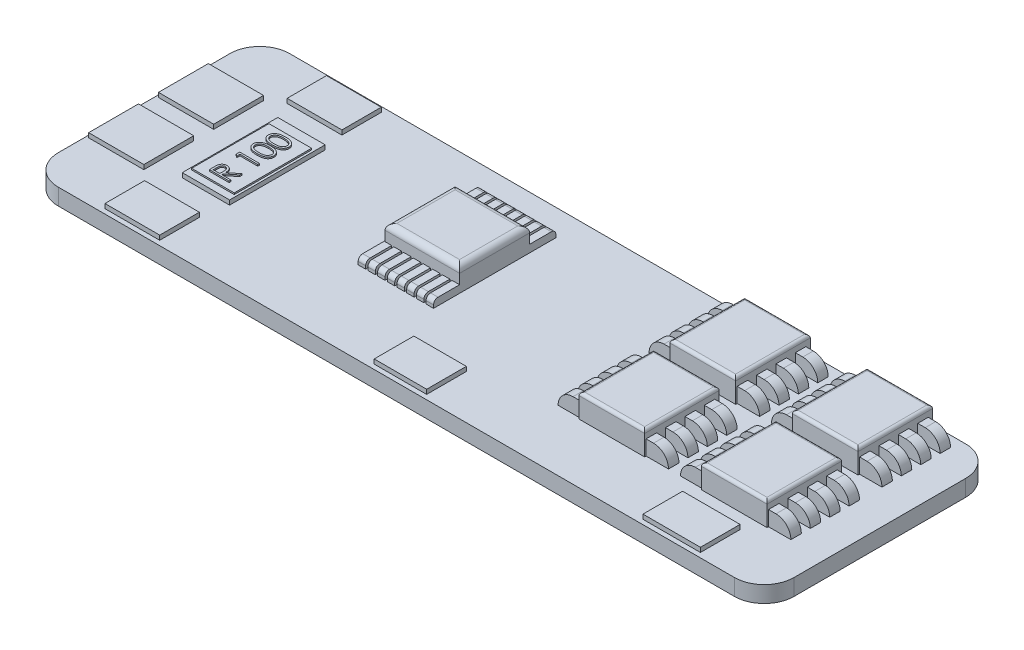
from build123d import *

# Parameters (mm, degrees)
SKETCH1_W                = 49.3
SKETCH1_H                = 15.5
BOSS_EXTRUDE1_DEPTH      = 1.1
SKETCH2_W                = 4.4
SKETCH2_H                = 5
BOSS_EXTRUDE2_DEPTH      = 1.56
SKETCH2_3_W              = 5
SKETCH2_3_H              = 4.7
BOSS_EXTRUDE3_DEPTH      = 1.56
FILLET1_R                = 0.2
SKETCH3_W                = 1.5
SKETCH3_H                = 0.7
BOSS_EXTRUDE4_DEPTH      = 1
FILLET2_R                = 1
LPATTERN1_COUNT          = 2
LPATTERN1_PITCH          = 8.2
FILLET1_OF_LPATTERN1_R   = 0.2
FILLET2_OF_LPATTERN1_R   = 1
LPATTERN2_START          = -1.23581691
LPATTERN2_DEPTH          = 5
LPATTERN2_START_2        = -0.93581691
LPATTERN2_2_DEPTH        = 0.7
LPATTERN2_START_3        = 0.36418309
LPATTERN2_3_DEPTH        = 0.7
LPATTERN2_START_4        = 1.66418309
LPATTERN2_4_DEPTH        = 0.7
LPATTERN2_START_5        = 2.96418309
LPATTERN2_5_DEPTH        = 0.7
LPATTERN2_START_6        = 7
LPATTERN2_6_DEPTH        = 15
BOSS_EXTRUDE5_DEPTH      = 0.3
BOSS_EXTRUDE5_DEPTH_BACK = 1.4
SKETCH4_W                = 3.516550639
SKETCH4_H                = 2.656524668
SKETCH4_W_2              = 3.85092248
SKETCH4_W_3              = 3.668693206
SKETCH4_W_4              = 3.699371939
SKETCH4_H_2              = 3.340875337
SKETCH4_H_3              = 3.340875338
SKETCH4_H_4              = 2.635388594
FILLET3_R                = 0.4
SKETCH5_W                = 0.5
SKETCH5_H                = 1.745261523
BOSS_EXTRUDE6_DEPTH      = 0.5
FILLET4_R                = 0.3
SKETCH6_W                = 2.855240174
SKETCH6_H                = 5.180879347
BOSS_EXTRUDE7_DEPTH      = 0.4
SKETCH7_W                = 3.172540251
SKETCH7_H                = 6.402415567
BOSS_EXTRUDE8_DEPTH      = 0.3
BOSS_EXTRUDE9_DEPTH      = 0.1
SKETCH9_OUTSIDE_W        = 61.652
SKETCH9_OUTSIDE_H        = 27.852
CUT_EXTRUDE1_DEPTH       = 10.1


with BuildPart() as part:
    # Sketch1 → Boss-Extrude1 (new body)
    with BuildSketch(Plane(origin=(0, 0, 0), x_dir=(1, 0, 0), z_dir=(0, 1, 0))):
        Rectangle(SKETCH1_W, SKETCH1_H)
    extrude(amount=BOSS_EXTRUDE1_DEPTH)

    # Sketch2 → Boss-Extrude2 (add)
    with BuildSketch(Plane(origin=(0, 1.1, 0), x_dir=(1, 0, 0), z_dir=(0, 1, 0))):
        with Locations((10.450484563, 4.83581691)):
            Rectangle(SKETCH2_W, SKETCH2_H)
    boss_extrude2 = extrude(amount=BOSS_EXTRUDE2_DEPTH)

    # Sketch2<3> → Boss-Extrude3 (add)
    with BuildSketch(Plane(origin=(0, 1.1, 0), x_dir=(1, 0, 0), z_dir=(0, 1, 0))):
        with Locations((-5.543162249, 1.881700591)):
            Rectangle(SKETCH2_3_W, SKETCH2_3_H)
    extrude(amount=BOSS_EXTRUDE3_DEPTH)

    # Fillet1
    fillet1_edges = [part.edges().sort_by_distance(p)[0] for p in [
        (12.650484563, 2.66, -4.83581691),
        (10.450484563, 2.66, -7.33581691),
        (8.250484563, 2.66, -4.83581691),
        (10.450484563, 2.66, -2.33581691),
    ]]
    fillet(fillet1_edges, radius=FILLET1_R)

    # Sketch3 → Boss-Extrude4 (add)
    with BuildSketch(Plane(origin=(0, 1.1, 0), x_dir=(1, 0, 0), z_dir=(0, 1, 0))):
        with Locations((7.500484563, 6.68581691)):
            Rectangle(SKETCH3_W, SKETCH3_H)
        with Locations((7.500484563, 5.38581691)):
            Rectangle(SKETCH3_W, SKETCH3_H)
        with Locations((7.500484563, 4.08581691)):
            Rectangle(SKETCH3_W, SKETCH3_H)
        with Locations((7.500484563, 2.78581691)):
            Rectangle(SKETCH3_W, SKETCH3_H)
        with Locations((13.400484563, 2.78581691)):
            Rectangle(SKETCH3_W, SKETCH3_H)
        with Locations((13.400484563, 4.08581691)):
            Rectangle(SKETCH3_W, SKETCH3_H)
        with Locations((13.400484563, 5.38581691)):
            Rectangle(SKETCH3_W, SKETCH3_H)
        with Locations((13.400484563, 6.68581691)):
            Rectangle(SKETCH3_W, SKETCH3_H)
    boss_extrude4 = extrude(amount=BOSS_EXTRUDE4_DEPTH)

    # Fillet2
    fillet2_edges = [part.edges().sort_by_distance(p)[0] for p in [
        (14.150484563, 2.1, -6.68581691),
        (14.150484563, 2.1, -5.38581691),
        (14.150484563, 2.1, -4.08581691),
        (14.150484563, 2.1, -2.78581691),
        (6.750484563, 2.1, -6.68581691),
        (6.750484563, 2.1, -5.38581691),
        (6.750484563, 2.1, -4.08581691),
        (6.750484563, 2.1, -2.78581691),
    ]]
    fillet(fillet2_edges, radius=FILLET2_R - 0.0001)  # a hair under: the kernel refuses the full size

    # LPattern1: Boss-Extrude2, Boss-Extrude4 ×2
    with Locations(*[(i * LPATTERN1_PITCH, 0, 0) for i in range(1, LPATTERN1_COUNT)]):
        add(boss_extrude2)
        add(boss_extrude4)

    # Fillet1 of LPattern1
    fillet1_of_lpattern1_edges = [part.edges().sort_by_distance(p)[0] for p in [
        (20.850484563, 2.66, -4.83581691),
        (18.650484563, 2.66, -7.33581691),
        (16.450484563, 2.66, -4.83581691),
        (18.650484563, 2.66, -2.33581691),
    ]]
    fillet(fillet1_of_lpattern1_edges, radius=FILLET1_OF_LPATTERN1_R)

    # Fillet2 of LPattern1
    fillet2_of_lpattern1_edges = [part.edges().sort_by_distance(p)[0] for p in [
        (22.350484563, 2.1, -6.68581691),
        (22.350484563, 2.1, -5.38581691),
        (22.350484563, 2.1, -4.08581691),
        (22.350484563, 2.1, -2.78581691),
        (14.950484563, 2.1, -6.68581691),
        (14.950484563, 2.1, -5.38581691),
        (14.950484563, 2.1, -4.08581691),
        (14.950484563, 2.1, -2.78581691),
    ]]
    fillet(fillet2_of_lpattern1_edges, radius=FILLET2_OF_LPATTERN1_R - 0.0001)  # a hair under: the kernel refuses the full size

    # LPattern2: read off the stored shape, not the designer's step
    # LPattern2 outline → LPattern2 (add)
    with BuildSketch(Plane.XY.offset(LPATTERN2_START)):
        with BuildLine():
            Line((16.450484563, 1.1), (20.850484563, 1.1))
            Line((20.850484563, 1.1), (20.850484563, 2.46))
            ThreePointArc((20.850484563, 2.46), (20.791905919, 2.601421356), (20.650484563, 2.66))
            Line((20.650484563, 2.66), (16.650484563, 2.66))
            ThreePointArc((16.650484563, 2.66), (16.509063206, 2.601421356), (16.450484563, 2.46))
            Line((16.450484563, 2.46), (16.450484563, 1.1))
        make_face()
        with BuildLine():
            Line((8.250484563, 1.1), (12.650484563, 1.1))
            Line((12.650484563, 1.1), (12.650484563, 2.46))
            ThreePointArc((12.650484563, 2.46), (12.591905919, 2.601421356), (12.450484563, 2.66))
            Line((12.450484563, 2.66), (8.450484563, 2.66))
            ThreePointArc((8.450484563, 2.66), (8.309063206, 2.601421357), (8.250484563, 2.46))
            Line((8.250484563, 2.46), (8.250484563, 1.1))
        make_face()
    extrude(amount=LPATTERN2_DEPTH)

    # LPattern2 2 outline → LPattern2 2 (add)
    with BuildSketch(Plane.XY.offset(LPATTERN2_START_2)):
        with BuildLine():
            Line((12.650484563, 1.1), (14.150484563, 1.1))
            ThreePointArc((14.150484563, 1.1), (13.857591344, 1.807106781), (13.150484563, 2.1))
            Line((13.150484563, 2.1), (12.650484563, 2.1))
            Line((12.650484563, 2.1), (12.650484563, 1.1))
        make_face()
        with BuildLine():
            Line((20.850484563, 2.1), (20.850484563, 1.1))
            Line((20.850484563, 1.1), (22.350484563, 1.1))
            ThreePointArc((22.350484563, 1.1), (22.057591344, 1.807106781), (21.350484563, 2.1))
            Line((21.350484563, 2.1), (20.850484563, 2.1))
        make_face()
        with BuildLine():
            Line((14.950484563, 1.1), (16.450484563, 1.1))
            Line((16.450484563, 1.1), (16.450484563, 2.1))
            Line((16.450484563, 2.1), (15.950484563, 2.1))
            ThreePointArc((15.950484563, 2.1), (15.243377781, 1.807106782), (14.950484563, 1.1))
        make_face()
        with BuildLine():
            Line((6.750484563, 1.1), (8.250484563, 1.1))
            Line((8.250484563, 1.1), (8.250484563, 2.1))
            Line((8.250484563, 2.1), (7.750484563, 2.1))
            ThreePointArc((7.750484563, 2.1), (7.043377782, 1.807106781), (6.750484563, 1.1))
        make_face()
    extrude(amount=LPATTERN2_2_DEPTH)

    # LPattern2 3 outline → LPattern2 3 (add)
    with BuildSketch(Plane.XY.offset(LPATTERN2_START_3)):
        with BuildLine():
            Line((12.650484563, 1.1), (14.150484563, 1.1))
            ThreePointArc((14.150484563, 1.1), (13.857591344, 1.807106781), (13.150484563, 2.1))
            Line((13.150484563, 2.1), (12.650484563, 2.1))
            Line((12.650484563, 2.1), (12.650484563, 1.1))
        make_face()
        with BuildLine():
            Line((20.850484563, 2.1), (20.850484563, 1.1))
            Line((20.850484563, 1.1), (22.350484563, 1.1))
            ThreePointArc((22.350484563, 1.1), (22.057591344, 1.807106781), (21.350484563, 2.1))
            Line((21.350484563, 2.1), (20.850484563, 2.1))
        make_face()
        with BuildLine():
            Line((14.950484563, 1.1), (16.450484563, 1.1))
            Line((16.450484563, 1.1), (16.450484563, 2.1))
            Line((16.450484563, 2.1), (15.950484563, 2.1))
            ThreePointArc((15.950484563, 2.1), (15.243377781, 1.807106782), (14.950484563, 1.1))
        make_face()
        with BuildLine():
            Line((6.750484563, 1.1), (8.250484563, 1.1))
            Line((8.250484563, 1.1), (8.250484563, 2.1))
            Line((8.250484563, 2.1), (7.750484563, 2.1))
            ThreePointArc((7.750484563, 2.1), (7.043377782, 1.807106781), (6.750484563, 1.1))
        make_face()
    extrude(amount=LPATTERN2_3_DEPTH)

    # LPattern2 4 outline → LPattern2 4 (add)
    with BuildSketch(Plane.XY.offset(LPATTERN2_START_4)):
        with BuildLine():
            Line((12.650484563, 1.1), (14.150484563, 1.1))
            ThreePointArc((14.150484563, 1.1), (13.857591344, 1.807106781), (13.150484563, 2.1))
            Line((13.150484563, 2.1), (12.650484563, 2.1))
            Line((12.650484563, 2.1), (12.650484563, 1.1))
        make_face()
        with BuildLine():
            Line((20.850484563, 2.1), (20.850484563, 1.1))
            Line((20.850484563, 1.1), (22.350484563, 1.1))
            ThreePointArc((22.350484563, 1.1), (22.057591344, 1.807106781), (21.350484563, 2.1))
            Line((21.350484563, 2.1), (20.850484563, 2.1))
        make_face()
        with BuildLine():
            Line((14.950484563, 1.1), (16.450484563, 1.1))
            Line((16.450484563, 1.1), (16.450484563, 2.1))
            Line((16.450484563, 2.1), (15.950484563, 2.1))
            ThreePointArc((15.950484563, 2.1), (15.243377781, 1.807106782), (14.950484563, 1.1))
        make_face()
        with BuildLine():
            Line((6.750484563, 1.1), (8.250484563, 1.1))
            Line((8.250484563, 1.1), (8.250484563, 2.1))
            Line((8.250484563, 2.1), (7.750484563, 2.1))
            ThreePointArc((7.750484563, 2.1), (7.043377782, 1.807106781), (6.750484563, 1.1))
        make_face()
    extrude(amount=LPATTERN2_4_DEPTH)

    # LPattern2 5 outline → LPattern2 5 (add)
    with BuildSketch(Plane.XY.offset(LPATTERN2_START_5)):
        with BuildLine():
            Line((12.650484563, 1.1), (14.150484563, 1.1))
            ThreePointArc((14.150484563, 1.1), (13.857591344, 1.807106781), (13.150484563, 2.1))
            Line((13.150484563, 2.1), (12.650484563, 2.1))
            Line((12.650484563, 2.1), (12.650484563, 1.1))
        make_face()
        with BuildLine():
            Line((20.850484563, 2.1), (20.850484563, 1.1))
            Line((20.850484563, 1.1), (22.350484563, 1.1))
            ThreePointArc((22.350484563, 1.1), (22.057591344, 1.807106781), (21.350484563, 2.1))
            Line((21.350484563, 2.1), (20.850484563, 2.1))
        make_face()
        with BuildLine():
            Line((14.950484563, 1.1), (16.450484563, 1.1))
            Line((16.450484563, 1.1), (16.450484563, 2.1))
            Line((16.450484563, 2.1), (15.950484563, 2.1))
            ThreePointArc((15.950484563, 2.1), (15.243377781, 1.807106782), (14.950484563, 1.1))
        make_face()
        with BuildLine():
            Line((6.750484563, 1.1), (8.250484563, 1.1))
            Line((8.250484563, 1.1), (8.250484563, 2.1))
            Line((8.250484563, 2.1), (7.750484563, 2.1))
            ThreePointArc((7.750484563, 2.1), (7.043377782, 1.807106781), (6.750484563, 1.1))
        make_face()
    extrude(amount=LPATTERN2_5_DEPTH)

    # LPattern2 6 outline → LPattern2 6 (cut)
    with BuildSketch(Plane.YZ.offset(LPATTERN2_START_6)):
        with BuildLine():
            ThreePointArc((2.46, 3.76418309), (2.601421356, 3.705604446), (2.66, 3.56418309))
            Line((2.66, 3.56418309), (2.66, 3.76418309))
            Line((2.66, 3.76418309), (2.46, 3.76418309))
        make_face()
        with BuildLine():
            ThreePointArc((2.66, -1.03581691), (2.601421356, -1.177238266), (2.46, -1.23581691))
            Line((2.46, -1.23581691), (2.66, -1.23581691))
            Line((2.66, -1.23581691), (2.66, -1.03581691))
        make_face()
    extrude(amount=LPATTERN2_6_DEPTH, mode=Mode.SUBTRACT)

    # Sketch4 → Boss-Extrude5 (add, two sides: drawn at the far end of the back side and taken through both)
    with BuildSketch(Plane(origin=(0, 1.1, 0), x_dir=(1, 0, 0), z_dir=(0, 1, 0)).offset(-BOSS_EXTRUDE5_DEPTH_BACK)):
        with Locations((-0.0391174, -6.107852092)):
            Rectangle(SKETCH4_W, SKETCH4_H)
        with Locations((18.136072358, -6.107852092)):
            Rectangle(SKETCH4_W_2, SKETCH4_H)
        with Locations((-18.002473825, -6.107852092)):
            Rectangle(SKETCH4_W_3, SKETCH4_H)
        with Locations((-22.644643835, -2.201996249)):
            Rectangle(SKETCH4_W_4, SKETCH4_H_2)
        with Locations((-22.644643835, 2.477296089)):
            Rectangle(SKETCH4_W_4, SKETCH4_H_3)
        with Locations((-18.002473825, 6.08996011)):
            Rectangle(SKETCH4_W_3, SKETCH4_H_4)
    extrude(amount=BOSS_EXTRUDE5_DEPTH + BOSS_EXTRUDE5_DEPTH_BACK)

    # Fillet3
    fillet3_edges = [part.edges().sort_by_distance(p)[0] for p in [
        (-3.043162249, 2.66, -1.881700591),
        (-5.543162249, 2.66, -4.231700591),
        (-8.043162249, 2.66, -1.881700591),
        (-5.543162249, 2.66, 0.468299409),
    ]]
    fillet(fillet3_edges, radius=FILLET3_R)

    # Sketch5 → Boss-Extrude6 (add)
    with BuildSketch(Plane(origin=(0, 1.1, 0), x_dir=(1, 0, 0), z_dir=(0, 1, 0))):
        with Locations((-3.293162249, 5.104331353)):
            Rectangle(SKETCH5_W, SKETCH5_H)
        with Locations((-3.943162249, 5.104331353)):
            Rectangle(SKETCH5_W, SKETCH5_H)
        with Locations((-4.593162249, 5.104331353)):
            Rectangle(SKETCH5_W, SKETCH5_H)
        with Locations((-5.243162249, 5.104331353)):
            Rectangle(SKETCH5_W, SKETCH5_H)
        with Locations((-5.893162249, 5.104331353)):
            Rectangle(SKETCH5_W, SKETCH5_H)
        with Locations((-6.543162249, 5.104331353)):
            Rectangle(SKETCH5_W, SKETCH5_H)
        with Locations((-7.193162249, 5.104331353)):
            Rectangle(SKETCH5_W, SKETCH5_H)
        with Locations((-7.843162249, 5.104331353)):
            Rectangle(SKETCH5_W, SKETCH5_H)
        with Locations((-7.843162249, -1.340930171)):
            Rectangle(SKETCH5_W, SKETCH5_H)
        with Locations((-7.193162249, -1.340930171)):
            Rectangle(SKETCH5_W, SKETCH5_H)
        with Locations((-6.543162249, -1.340930171)):
            Rectangle(SKETCH5_W, SKETCH5_H)
        with Locations((-5.893162249, -1.340930171)):
            Rectangle(SKETCH5_W, SKETCH5_H)
        with Locations((-5.243162249, -1.340930171)):
            Rectangle(SKETCH5_W, SKETCH5_H)
        with Locations((-4.593162249, -1.340930171)):
            Rectangle(SKETCH5_W, SKETCH5_H)
        with Locations((-3.943162249, -1.340930171)):
            Rectangle(SKETCH5_W, SKETCH5_H)
        with Locations((-3.293162249, -1.340930171)):
            Rectangle(SKETCH5_W, SKETCH5_H)
    extrude(amount=BOSS_EXTRUDE6_DEPTH)

    # Fillet4
    fillet4_edges = [part.edges().sort_by_distance(p)[0] for p in [
        (-6.543162249, 1.6, 2.213560932),
        (-5.893162249, 1.6, 2.213560932),
        (-5.243162249, 1.6, 2.213560932),
        (-4.593162249, 1.6, 2.213560932),
        (-3.943162249, 1.6, 2.213560932),
        (-3.293162249, 1.6, 2.213560932),
        (-3.293162249, 1.6, -5.976962114),
        (-3.943162249, 1.6, -5.976962114),
        (-4.593162249, 1.6, -5.976962114),
        (-5.243162249, 1.6, -5.976962114),
        (-5.893162249, 1.6, -5.976962114),
        (-6.543162249, 1.6, -5.976962114),
        (-7.193162249, 1.6, -5.976962114),
        (-7.843162249, 1.6, -5.976962114),
        (-7.843162249, 1.6, 2.213560932),
        (-7.193162249, 1.6, 2.213560932),
    ]]
    fillet(fillet4_edges, radius=FILLET4_R)

    # Sketch6 → Boss-Extrude7 (add)
    with BuildSketch(Plane(origin=(0, 1.1, 0), x_dir=(1, 0, 0), z_dir=(0, 1, 0))):
        with Locations((-17.448292854, 0.001508566)):
            Rectangle(SKETCH6_W, SKETCH6_H)
    extrude(amount=BOSS_EXTRUDE7_DEPTH)

    # Sketch7 → Boss-Extrude8 (add)
    with BuildSketch(Plane(origin=(0, 1.1, 0), x_dir=(1, 0, 0), z_dir=(0, 1, 0))):
        with Locations((-17.452057565, 0.146030741)):
            Rectangle(SKETCH7_W, SKETCH7_H)
    extrude(amount=BOSS_EXTRUDE8_DEPTH)

    # Sketch8 → Boss-Extrude9 (add)
    # profile 1 of 4: a face of its own
    with BuildSketch(Plane(origin=(0, 1.5, 0), x_dir=(1, 0, 0), z_dir=(0, 1, 0))):
        with BuildLine():
            add(Edge.make_bspline(
                [(-17.446164705, 1.375306642), (-17.467368182, 1.375430626), (-17.508556242, 1.375671464), (-17.568573056, 1.378350719), (-17.624876498, 1.382801518), (-17.677469264, 1.388901061), (-17.726364932, 1.396323749), (-17.771432828, 1.406232581), (-17.812881559, 1.417501101), (-17.850846227, 1.430561136), (-17.885838514, 1.44529748), (-17.918504761, 1.461337013), (-17.948797997, 1.479313981), (-17.977192952, 1.498209039), (-18.003255954, 1.518757768), (-18.027287297, 1.540519566), (-18.049084323, 1.56392967), (-18.068661956, 1.588761025), (-18.085828683, 1.614845336), (-18.101042848, 1.641469818), (-18.113574674, 1.669110189), (-18.123826053, 1.697402581), (-18.13219449, 1.726406623), (-18.137942749, 1.756114911), (-18.141553112, 1.78659631), (-18.141898719, 1.807169975), (-18.142073994, 1.817603901)],
                knots=[0, 0, 0, 0, 1.646148282, 3.197666765, 4.66315463, 6.030252048, 7.307778049, 8.501004361, 9.610818041, 10.641065266, 11.615491391, 12.557119604, 13.464013759, 14.348536654, 15.203310953, 16.038349431, 16.863300206, 17.683791446, 18.490318933, 19.285717724, 20.06220424, 20.843281102, 21.620494212, 22.403315558, 23.190242141, 24, 24, 24, 24], degree=3))
            add(Edge.make_bspline(
                [(-18.142073994, 1.817603901), (-18.141928, 1.828130152), (-18.141637525, 1.849073686), (-18.137548912, 1.879926048), (-18.13227162, 1.910241015), (-18.123807713, 1.939558649), (-18.113679552, 1.968433289), (-18.100315603, 1.996146882), (-18.085781271, 2.023677863), (-18.068050608, 2.049775537), (-18.048455308, 2.075219655), (-18.026209633, 2.099070859), (-18.001929234, 2.12193885), (-17.975072588, 2.142959912), (-17.946051487, 2.16303498), (-17.914622649, 2.181401982), (-17.880855727, 2.19844292), (-17.844907257, 2.214478118), (-17.805817002, 2.228500474), (-17.763828776, 2.240967471), (-17.718562357, 2.251186283), (-17.670269908, 2.259637062), (-17.618712187, 2.266196475), (-17.563993657, 2.270970305), (-17.506080086, 2.273492859), (-17.466484101, 2.273967821), (-17.446164705, 2.274211557)],
                knots=[0, 0, 0, 0, 0.810910589, 1.61342667, 2.396193133, 3.181089899, 3.963115317, 4.752255436, 5.550715454, 6.36105385, 7.181178335, 8.024612154, 8.872680183, 9.750181803, 10.651284446, 11.591556747, 12.554036451, 13.566402641, 14.62422919, 15.753422176, 16.94128843, 18.199818041, 19.531985927, 20.947085226, 22.433341622, 24, 24, 24, 24], degree=3))
            add(Edge.make_bspline(
                [(-17.446164705, 2.274211557), (-17.42593412, 2.273962459), (-17.386427412, 2.273476015), (-17.328771707, 2.271024406), (-17.274348122, 2.266079872), (-17.223098633, 2.259985112), (-17.174999479, 2.25143988), (-17.130082001, 2.241143581), (-17.088187172, 2.229412481), (-17.049615161, 2.215174919), (-17.013729073, 2.199512953), (-16.980210436, 2.182490302), (-16.948789899, 2.164226947), (-16.91969225, 2.144452959), (-16.892943402, 2.123086122), (-16.868579726, 2.10023416), (-16.846192559, 2.076174707), (-16.826381377, 2.050582254), (-16.808515722, 2.024241496), (-16.793453947, 1.996707718), (-16.780403803, 1.968685583), (-16.769734106, 1.939895317), (-16.761459632, 1.910381371), (-16.755771381, 1.880045626), (-16.751772978, 1.849069332), (-16.751468485, 1.828128696), (-16.751315447, 1.817603901)],
                knots=[0, 0, 0, 0, 1.561645053, 3.049612875, 4.452756685, 5.778837748, 7.032101753, 8.221335837, 9.334924186, 10.387562255, 11.392109817, 12.355697819, 13.287721948, 14.19548756, 15.068665045, 15.927346723, 16.771751757, 17.602390507, 18.423119567, 19.225778204, 20.022010933, 20.807278863, 21.593079439, 22.384715467, 23.188155646, 24, 24, 24, 24], degree=3))
            add(Edge.make_bspline(
                [(-16.751315447, 1.817603901), (-16.751491718, 1.807170204), (-16.75183929, 1.786596988), (-16.755435254, 1.756112291), (-16.76121659, 1.726523392), (-16.769311556, 1.697684278), (-16.779220143, 1.669446999), (-16.792129411, 1.642196302), (-16.806996796, 1.615629296), (-16.823928233, 1.589816468), (-16.84332724, 1.565244356), (-16.864780379, 1.541768992), (-16.88883778, 1.520001828), (-16.915120687, 1.499631275), (-16.943557888, 1.480536462), (-16.974168468, 1.462714839), (-17.007004695, 1.446338945), (-17.042273529, 1.431350832), (-17.080507653, 1.418062198), (-17.12206204, 1.406369498), (-17.16735876, 1.397030897), (-17.21616783, 1.389114989), (-17.268588428, 1.382771869), (-17.324639519, 1.378352567), (-17.384214667, 1.375673498), (-17.425137865, 1.375431159), (-17.446164705, 1.375306642)],
                knots=[0, 0, 0, 0, 0.810927267, 1.598990287, 2.382942141, 3.152806972, 3.926217614, 4.706701772, 5.493896336, 6.292070767, 7.104102563, 7.925577746, 8.761822141, 9.623241997, 10.509042271, 11.423174113, 12.375371989, 13.360203808, 14.400680605, 15.520553799, 16.714061498, 17.994519714, 19.364400916, 20.818312473, 22.365209998, 24, 24, 24, 24], degree=3))
        make_face()
        with BuildLine():
            add(Edge.make_bspline(
                [(-17.44669472, 1.494029933), (-17.429024896, 1.494076071), (-17.394731236, 1.494165616), (-17.344984722, 1.496437218), (-17.29850819, 1.499599056), (-17.25531978, 1.503576831), (-17.215570433, 1.509534114), (-17.179094897, 1.516293016), (-17.145960688, 1.524399906), (-17.115878251, 1.534039109), (-17.088421609, 1.545019099), (-17.062858942, 1.55698627), (-17.038887288, 1.569956335), (-17.016564803, 1.584195153), (-16.996164357, 1.599984235), (-16.977168844, 1.616591597), (-16.960238911, 1.634765392), (-16.939930718, 1.659901106), (-16.918946148, 1.69308661), (-16.900672374, 1.734898349), (-16.889188555, 1.777862357), (-16.887728144, 1.807023688), (-16.886999207, 1.821579012)],
                knots=[0, 0, 0, 0, 1.459098681, 2.831824031, 4.11146945, 5.306290378, 6.412266529, 7.42953815, 8.369053297, 9.227277979, 10.03601793, 10.809473603, 11.557037441, 12.285528272, 12.993193355, 13.685654407, 14.36688038, 15.041354379, 16.352855396, 17.594313975, 18.799247529, 20, 20, 20, 20], degree=3))
            add(Edge.make_bspline(
                [(-16.886999207, 1.821579012), (-16.887637478, 1.836218591), (-16.888911756, 1.865445819), (-16.900033151, 1.908370361), (-16.918113008, 1.949696949), (-16.938768816, 1.982311455), (-16.958565958, 2.007055137), (-16.975425465, 2.024790118), (-16.994308641, 2.041066136), (-17.014681001, 2.056503582), (-17.036933479, 2.070662189), (-17.060958596, 2.083537253), (-17.086823202, 2.095286016), (-17.104879026, 2.101979614), (-17.114110502, 2.105401878)],
                knots=[0, 0, 0, 0, 1.353621445, 2.702441307, 4.075953605, 5.516772412, 6.261413105, 7.007624062, 7.778524365, 8.566925914, 9.372323995, 10.217594641, 11.088702136, 12, 12, 12, 12], degree=3))
            add(Edge.make_bspline(
                [(-17.114110502, 2.105401878), (-17.1259146, 2.109390195), (-17.149881981, 2.117488189), (-17.1870611, 2.127924782), (-17.226069287, 2.136144026), (-17.266673423, 2.143538512), (-17.309172953, 2.148585649), (-17.353436378, 2.152648067), (-17.399497072, 2.155040916), (-17.430791607, 2.155337533), (-17.44669472, 2.155488266)],
                knots=[0, 0, 0, 0, 0.884706709, 1.796334032, 2.740027952, 3.714592787, 4.726048262, 5.777819803, 6.87074269, 8, 8, 8, 8], degree=3))
            add(Edge.make_bspline(
                [(-17.44669472, 2.155488266), (-17.462595261, 2.155280308), (-17.493700118, 2.154873497), (-17.539253121, 2.153318507), (-17.582519209, 2.149303049), (-17.623684774, 2.144843263), (-17.662521943, 2.138267529), (-17.699355835, 2.131177521), (-17.733730144, 2.121652073), (-17.766182984, 2.111477003), (-17.796345861, 2.099831533), (-17.824358662, 2.08701176), (-17.850359207, 2.073322311), (-17.874267162, 2.058446591), (-17.896221204, 2.042591806), (-17.915716171, 2.025189491), (-17.933700385, 2.007344821), (-17.953862018, 1.98196594), (-17.974581424, 1.94901069), (-17.993129996, 1.907720361), (-18.004107542, 1.864986649), (-18.005629885, 1.836037791), (-18.006390233, 1.821579012)],
                knots=[0, 0, 0, 0, 1.313483664, 2.569454835, 3.763100662, 4.901599063, 5.988328865, 7.015709358, 7.99797933, 8.932480776, 9.824041341, 10.666387587, 11.475829342, 12.24921787, 12.990555181, 13.709176526, 14.405678811, 15.080244297, 16.38186033, 17.610124501, 18.806354173, 20, 20, 20, 20], degree=3))
            add(Edge.make_bspline(
                [(-18.006390233, 1.821579012), (-18.005627993, 1.806945107), (-18.004102124, 1.777650638), (-17.993180764, 1.73446057), (-17.974635693, 1.692891299), (-17.953901936, 1.659827376), (-17.933777687, 1.634756805), (-17.916649634, 1.61696614), (-17.89810782, 1.600128457), (-17.877526398, 1.584748231), (-17.855282567, 1.570593845), (-17.831620908, 1.557122533), (-17.806010478, 1.545315395), (-17.778575365, 1.534300154), (-17.748491274, 1.524644873), (-17.715237174, 1.516630613), (-17.678674532, 1.509334577), (-17.638634753, 1.504080242), (-17.595437125, 1.499453451), (-17.548841738, 1.49647193), (-17.498924399, 1.49415521), (-17.464453309, 1.494072528), (-17.44669472, 1.494029933)],
                knots=[0, 0, 0, 0, 1.207546505, 2.417292871, 3.651582144, 4.952510111, 5.626719005, 6.30238548, 6.989136872, 7.692112372, 8.420316868, 9.164734959, 9.937886623, 10.746308695, 11.604196049, 12.543341915, 13.568754172, 14.680483261, 15.875568977, 17.154711427, 18.534182925, 20, 20, 20, 20], degree=3))
        make_face(mode=Mode.SUBTRACT)
    # profile 2 of 4: a face of its own
    with BuildSketch(Plane(origin=(0, 1.5, 0), x_dir=(1, 0, 0), z_dir=(0, 1, 0))):
        with BuildLine():
            add(Edge.make_bspline(
                [(-17.446164705, 0.357678437), (-17.467368182, 0.35780242), (-17.508556242, 0.358043259), (-17.568573056, 0.360722514), (-17.624876498, 0.365173313), (-17.677469264, 0.371272856), (-17.726364932, 0.378695544), (-17.771432828, 0.388604376), (-17.812881559, 0.399872896), (-17.850846227, 0.41293293), (-17.885838514, 0.427669275), (-17.918504761, 0.443708808), (-17.948797997, 0.461685776), (-17.977192952, 0.480580834), (-18.003255954, 0.501129563), (-18.027287297, 0.522891361), (-18.049084323, 0.546301465), (-18.068661956, 0.57113282), (-18.085828683, 0.597217131), (-18.101042848, 0.623841613), (-18.113574674, 0.651481984), (-18.123826053, 0.679774376), (-18.13219449, 0.708778418), (-18.137942749, 0.738486705), (-18.141553112, 0.768968104), (-18.141898719, 0.78954177), (-18.142073994, 0.799975696)],
                knots=[0, 0, 0, 0, 1.646148282, 3.197666765, 4.66315463, 6.030252048, 7.307778049, 8.501004361, 9.610818041, 10.641065266, 11.615491391, 12.557119604, 13.464013759, 14.348536654, 15.203310953, 16.038349431, 16.863300206, 17.683791446, 18.490318933, 19.285717724, 20.06220424, 20.843281102, 21.620494212, 22.403315558, 23.190242141, 24, 24, 24, 24], degree=3))
            add(Edge.make_bspline(
                [(-18.142073994, 0.799975696), (-18.141928, 0.810501947), (-18.141637525, 0.831445481), (-18.137548912, 0.862297843), (-18.13227162, 0.89261281), (-18.123807713, 0.921930444), (-18.113679552, 0.950805084), (-18.100315603, 0.978518677), (-18.085781271, 1.006049658), (-18.068050608, 1.032147332), (-18.048455308, 1.05759145), (-18.026209633, 1.081442654), (-18.001929234, 1.104310645), (-17.975072588, 1.125331707), (-17.946051487, 1.145406774), (-17.914622649, 1.163773777), (-17.880855727, 1.180814715), (-17.844907257, 1.196849912), (-17.805817002, 1.210872269), (-17.763828776, 1.223339265), (-17.718562357, 1.233558078), (-17.670269908, 1.242008857), (-17.618712187, 1.24856827), (-17.563993657, 1.253342099), (-17.506080086, 1.255864653), (-17.466484101, 1.256339616), (-17.446164705, 1.256583352)],
                knots=[0, 0, 0, 0, 0.810910589, 1.61342667, 2.396193133, 3.181089899, 3.963115317, 4.752255436, 5.550715454, 6.36105385, 7.181178335, 8.024612154, 8.872680183, 9.750181803, 10.651284446, 11.591556747, 12.554036451, 13.566402641, 14.62422919, 15.753422176, 16.94128843, 18.199818041, 19.531985927, 20.947085226, 22.433341622, 24, 24, 24, 24], degree=3))
            add(Edge.make_bspline(
                [(-17.446164705, 1.256583352), (-17.42593412, 1.256334254), (-17.386427412, 1.25584781), (-17.328771707, 1.253396201), (-17.274348122, 1.248451667), (-17.223098633, 1.242356906), (-17.174999479, 1.233811674), (-17.130082001, 1.223515376), (-17.088187172, 1.211784276), (-17.049615161, 1.197546714), (-17.013729073, 1.181884748), (-16.980210436, 1.164862097), (-16.948789899, 1.146598742), (-16.91969225, 1.126824754), (-16.892943402, 1.105457917), (-16.868579726, 1.082605955), (-16.846192559, 1.058546501), (-16.826381377, 1.032954049), (-16.808515722, 1.006613291), (-16.793453947, 0.979079512), (-16.780403803, 0.951057378), (-16.769734106, 0.922267112), (-16.761459632, 0.892753166), (-16.755771381, 0.86241742), (-16.751772978, 0.831441127), (-16.751468485, 0.81050049), (-16.751315447, 0.799975696)],
                knots=[0, 0, 0, 0, 1.561645053, 3.049612875, 4.452756685, 5.778837748, 7.032101753, 8.221335837, 9.334924186, 10.387562255, 11.392109817, 12.355697819, 13.287721948, 14.19548756, 15.068665045, 15.927346723, 16.771751757, 17.602390507, 18.423119567, 19.225778204, 20.022010933, 20.807278863, 21.593079439, 22.384715467, 23.188155646, 24, 24, 24, 24], degree=3))
            add(Edge.make_bspline(
                [(-16.751315447, 0.799975696), (-16.751491718, 0.789541998), (-16.75183929, 0.768968783), (-16.755435254, 0.738484086), (-16.76121659, 0.708895187), (-16.769311556, 0.680056073), (-16.779220143, 0.651818794), (-16.792129411, 0.624568097), (-16.806996796, 0.59800109), (-16.823928233, 0.572188263), (-16.84332724, 0.547616151), (-16.864780379, 0.524140787), (-16.88883778, 0.502373623), (-16.915120687, 0.48200307), (-16.943557888, 0.462908257), (-16.974168468, 0.445086634), (-17.007004695, 0.42871074), (-17.042273529, 0.413722627), (-17.080507653, 0.400433993), (-17.12206204, 0.388741293), (-17.16735876, 0.379402692), (-17.21616783, 0.371486784), (-17.268588428, 0.365143663), (-17.324639519, 0.360724362), (-17.384214667, 0.358045293), (-17.425137865, 0.357802954), (-17.446164705, 0.357678437)],
                knots=[0, 0, 0, 0, 0.810927267, 1.598990287, 2.382942141, 3.152806972, 3.926217614, 4.706701772, 5.493896336, 6.292070767, 7.104102563, 7.925577746, 8.761822141, 9.623241997, 10.509042271, 11.423174113, 12.375371989, 13.360203808, 14.400680605, 15.520553799, 16.714061498, 17.994519714, 19.364400916, 20.818312473, 22.365209998, 24, 24, 24, 24], degree=3))
        make_face()
        with BuildLine():
            add(Edge.make_bspline(
                [(-17.44669472, 0.476401728), (-17.429024896, 0.476447866), (-17.394731236, 0.476537411), (-17.344984722, 0.478809013), (-17.29850819, 0.481970851), (-17.25531978, 0.485948626), (-17.215570433, 0.491905909), (-17.179094897, 0.49866481), (-17.145960688, 0.506771701), (-17.115878251, 0.516410903), (-17.088421609, 0.527390894), (-17.062858942, 0.539358065), (-17.038887288, 0.55232813), (-17.016564803, 0.566566948), (-16.996164357, 0.58235603), (-16.977168844, 0.598963392), (-16.960238911, 0.617137187), (-16.939930718, 0.642272901), (-16.918946148, 0.675458405), (-16.900672374, 0.717270144), (-16.889188555, 0.760234152), (-16.887728144, 0.789395483), (-16.886999207, 0.803950806)],
                knots=[0, 0, 0, 0, 1.459098681, 2.831824031, 4.11146945, 5.306290378, 6.412266529, 7.42953815, 8.369053297, 9.227277979, 10.03601793, 10.809473603, 11.557037441, 12.285528272, 12.993193355, 13.685654407, 14.36688038, 15.041354379, 16.352855396, 17.594313975, 18.799247529, 20, 20, 20, 20], degree=3))
            add(Edge.make_bspline(
                [(-16.886999207, 0.803950806), (-16.887637478, 0.818590386), (-16.888911756, 0.847817614), (-16.900033151, 0.890742155), (-16.918113008, 0.932068744), (-16.938768816, 0.96468325), (-16.958565958, 0.989426931), (-16.975425465, 1.007161913), (-16.994308641, 1.023437931), (-17.014681001, 1.038875377), (-17.036933479, 1.053033984), (-17.060958596, 1.065909048), (-17.086823202, 1.077657811), (-17.104879026, 1.084351409), (-17.114110502, 1.087773673)],
                knots=[0, 0, 0, 0, 1.353621445, 2.702441307, 4.075953605, 5.516772412, 6.261413105, 7.007624062, 7.778524365, 8.566925914, 9.372323995, 10.217594641, 11.088702136, 12, 12, 12, 12], degree=3))
            add(Edge.make_bspline(
                [(-17.114110502, 1.087773673), (-17.1259146, 1.09176199), (-17.149881981, 1.099859984), (-17.1870611, 1.110296577), (-17.226069287, 1.11851582), (-17.266673423, 1.125910307), (-17.309172953, 1.130957444), (-17.353436378, 1.135019862), (-17.399497072, 1.13741271), (-17.430791607, 1.137709328), (-17.44669472, 1.137860061)],
                knots=[0, 0, 0, 0, 0.884706709, 1.796334032, 2.740027952, 3.714592787, 4.726048262, 5.777819803, 6.87074269, 8, 8, 8, 8], degree=3))
            add(Edge.make_bspline(
                [(-17.44669472, 1.137860061), (-17.462595261, 1.137652103), (-17.493700118, 1.137245292), (-17.539253121, 1.135690302), (-17.582519209, 1.131674844), (-17.623684774, 1.127215058), (-17.662521943, 1.120639323), (-17.699355835, 1.113549316), (-17.733730144, 1.104023868), (-17.766182984, 1.093848798), (-17.796345861, 1.082203327), (-17.824358662, 1.069383555), (-17.850359207, 1.055694106), (-17.874267162, 1.040818386), (-17.896221204, 1.024963601), (-17.915716171, 1.007561285), (-17.933700385, 0.989716616), (-17.953862018, 0.964337735), (-17.974581424, 0.931382485), (-17.993129996, 0.890092155), (-18.004107542, 0.847358444), (-18.005629885, 0.818409586), (-18.006390233, 0.803950806)],
                knots=[0, 0, 0, 0, 1.313483664, 2.569454835, 3.763100662, 4.901599063, 5.988328865, 7.015709358, 7.99797933, 8.932480776, 9.824041341, 10.666387587, 11.475829342, 12.24921787, 12.990555181, 13.709176526, 14.405678811, 15.080244297, 16.38186033, 17.610124501, 18.806354173, 20, 20, 20, 20], degree=3))
            add(Edge.make_bspline(
                [(-18.006390233, 0.803950806), (-18.005627993, 0.789316902), (-18.004102124, 0.760022433), (-17.993180764, 0.716832365), (-17.974635693, 0.675263094), (-17.953901936, 0.64219917), (-17.933777687, 0.6171286), (-17.916649634, 0.599337935), (-17.89810782, 0.582500252), (-17.877526398, 0.567120026), (-17.855282567, 0.55296564), (-17.831620908, 0.539494328), (-17.806010478, 0.52768719), (-17.778575365, 0.516671949), (-17.748491274, 0.507016668), (-17.715237174, 0.499002408), (-17.678674532, 0.491706372), (-17.638634753, 0.486452037), (-17.595437125, 0.481825246), (-17.548841738, 0.478843724), (-17.498924399, 0.476527005), (-17.464453309, 0.476444323), (-17.44669472, 0.476401728)],
                knots=[0, 0, 0, 0, 1.207546505, 2.417292871, 3.651582144, 4.952510111, 5.626719005, 6.30238548, 6.989136872, 7.692112372, 8.420316868, 9.164734959, 9.937886623, 10.746308695, 11.604196049, 12.543341915, 13.568754172, 14.680483261, 15.875568977, 17.154711427, 18.534182925, 20, 20, 20, 20], degree=3))
        make_face(mode=Mode.SUBTRACT)
    # profile 3 of 4: a face of its own
    with BuildSketch(Plane(origin=(0, 1.5, 0), x_dir=(1, 0, 0), z_dir=(0, 1, 0))):
        Polygon((-18.108153053, -0.378776975), (-18.108153053, -0.134175195), (-16.785236387, -0.134175195), (-16.785236387, -0.252898486), (-17.972469293, -0.252898486), (-17.972469293, -0.456424127), align=None)
    # profile 4 of 4: a face of its own
    with BuildSketch(Plane(origin=(0, 1.5, 0), x_dir=(1, 0, 0), z_dir=(0, 1, 0))):
        with BuildLine():
            Line((-18.108153053, -2.169431605), (-18.108153053, -1.904689268))
            add(Edge.make_bspline(
                [(-18.108153053, -1.904689268), (-18.108094246, -1.887022234), (-18.107981328, -1.853099572), (-18.107351709, -1.804501937), (-18.105547117, -1.760344076), (-18.10399417, -1.720649077), (-18.101162394, -1.685417669), (-18.09845584, -1.654541818), (-18.09491282, -1.62816373), (-18.091622377, -1.612195804), (-18.090132554, -1.60496596)],
                knots=[0, 0, 0, 0, 1.410062039, 2.707475311, 3.878576406, 4.937260626, 5.877586885, 6.699081471, 7.410979367, 8, 8, 8, 8], degree=3))
            add(Edge.make_bspline(
                [(-18.090132554, -1.60496596), (-18.087741181, -1.595287274), (-18.083009449, -1.576136373), (-18.073008443, -1.548562876), (-18.06143461, -1.522288519), (-18.047842436, -1.497420063), (-18.032123492, -1.474090858), (-18.014577124, -1.452027504), (-17.99523877, -1.43130162), (-17.973934103, -1.412183696), (-17.951117049, -1.394817908), (-17.92685023, -1.379585437), (-17.901233985, -1.366714279), (-17.874228414, -1.356613724), (-17.846131835, -1.348138248), (-17.816657479, -1.342443773), (-17.785903742, -1.338896671), (-17.764978478, -1.338546252), (-17.754368248, -1.338368571)],
                knots=[0, 0, 0, 0, 1.02737844, 2.032840108, 3.019645024, 3.985760442, 4.950801802, 5.916702504, 6.889791722, 7.870143693, 8.864820395, 9.842884691, 10.820524757, 11.815201459, 12.812418953, 13.84314332, 14.906358105, 16, 16, 16, 16], degree=3))
            add(Edge.make_bspline(
                [(-17.754368248, -1.338368571), (-17.736741288, -1.338923818), (-17.702346526, -1.340007247), (-17.652430657, -1.3501087), (-17.605868029, -1.366655182), (-17.56271727, -1.389455949), (-17.523819496, -1.418491882), (-17.489654056, -1.453388454), (-17.46106397, -1.494165135), (-17.441238059, -1.532125025), (-17.428540739, -1.565656881), (-17.419606758, -1.593261734), (-17.41270417, -1.623373955), (-17.40652043, -1.65570503), (-17.401851784, -1.690389507), (-17.398432386, -1.727344254), (-17.396295291, -1.766595627), (-17.395977033, -1.793560097), (-17.39581331, -1.807431572)],
                knots=[0, 0, 0, 0, 1.260483769, 2.459530307, 3.627416485, 4.787058657, 5.939039949, 7.08810263, 8.267026773, 9.491475466, 10.141966685, 10.831826277, 11.566392101, 12.351337768, 13.187381173, 14.07005841, 15.007169909, 16, 16, 16, 16], degree=3))
            Line((-17.39581331, -1.807431572), (-16.785236387, -1.321408101))
            Line((-16.785236387, -1.321408101), (-16.785236387, -1.46822217))
            Line((-16.785236387, -1.46822217), (-17.39581331, -1.954245641))
            Line((-17.39581331, -1.954245641), (-17.39581331, -2.050708315))
            Line((-17.39581331, -2.050708315), (-16.785236387, -2.050708315))
            Line((-16.785236387, -2.050708315), (-16.785236387, -2.169431605))
            Line((-16.785236387, -2.169431605), (-18.108153053, -2.169431605))
        make_face()
        with BuildLine():
            Line((-17.972469293, -2.050708315), (-17.53149707, -2.050708315))
            Line((-17.53149707, -2.050708315), (-17.529642019, -1.808491601))
            add(Edge.make_bspline(
                [(-17.529642019, -1.808491601), (-17.529637013, -1.797182538), (-17.52962731, -1.775262351), (-17.531136902, -1.743549917), (-17.532854034, -1.714022307), (-17.535481168, -1.686792845), (-17.538864881, -1.6618481), (-17.543104134, -1.639204683), (-17.548021889, -1.618812122), (-17.555712296, -1.595105523), (-17.567364255, -1.568320474), (-17.58546184, -1.539847394), (-17.607207419, -1.514864551), (-17.632791269, -1.49451788), (-17.660473775, -1.477470685), (-17.690538456, -1.465998601), (-17.722010044, -1.458352944), (-17.743633476, -1.457517069), (-17.754633255, -1.457091862)],
                knots=[0, 0, 0, 0, 1.146477201, 2.22219935, 3.21835465, 4.145220026, 4.995151787, 5.769831222, 6.480173269, 7.120302478, 8.295254187, 9.430763426, 10.528629691, 11.636497428, 12.733230534, 13.811001502, 14.886462612, 16, 16, 16, 16], degree=3))
            add(Edge.make_bspline(
                [(-17.754633255, -1.457091862), (-17.765271122, -1.457547546), (-17.786351493, -1.458450547), (-17.817228201, -1.465782492), (-17.846378679, -1.478317186), (-17.873840564, -1.494806631), (-17.898379272, -1.515500955), (-17.919602918, -1.539300048), (-17.936977394, -1.566199332), (-17.948525101, -1.591118929), (-17.955306559, -1.613570987), (-17.960235536, -1.632972141), (-17.96365643, -1.655001378), (-17.96689664, -1.679558518), (-17.969519677, -1.706690426), (-17.971329013, -1.736476623), (-17.972388641, -1.768732593), (-17.972441783, -1.791088624), (-17.972469293, -1.80266144)],
                knots=[0, 0, 0, 0, 1.100823979, 2.181431445, 3.263702604, 4.376021382, 5.48638238, 6.575013887, 7.666064109, 8.791843368, 9.405226397, 10.093019944, 10.863016055, 11.711746407, 12.658404307, 13.684961631, 14.801597923, 16, 16, 16, 16], degree=3))
            Line((-17.972469293, -1.80266144), (-17.972469293, -2.050708315))
        make_face(mode=Mode.SUBTRACT)
    extrude(amount=BOSS_EXTRUDE9_DEPTH)

    # Sketch9 outside → Cut-Extrude1 (cut)
    with BuildSketch(Plane(origin=(0, 1.1, 0), x_dir=(1, 0, 0), z_dir=(0, 1, 0))):
        Rectangle(SKETCH9_OUTSIDE_W, SKETCH9_OUTSIDE_H)
        with BuildLine():
            Line((-22.65, 7.75), (22.65, 7.75))
            ThreePointArc((22.65, 7.75), (24.064213562, 7.164213562), (24.65, 5.75))
            Line((24.65, 5.75), (24.65, -5.75))
            ThreePointArc((24.65, -5.75), (24.064213562, -7.164213562), (22.65, -7.75))
            Line((22.65, -7.75), (-22.65, -7.75))
            ThreePointArc((-22.65, -7.75), (-24.064213562, -7.164213562), (-24.65, -5.75))
            Line((-24.65, -5.75), (-24.65, 5.75))
            ThreePointArc((-24.65, 5.75), (-24.064213562, 7.164213562), (-22.65, 7.75))
        make_face(mode=Mode.SUBTRACT)
    extrude(amount=-CUT_EXTRUDE1_DEPTH, mode=Mode.SUBTRACT)


solid = part.part
